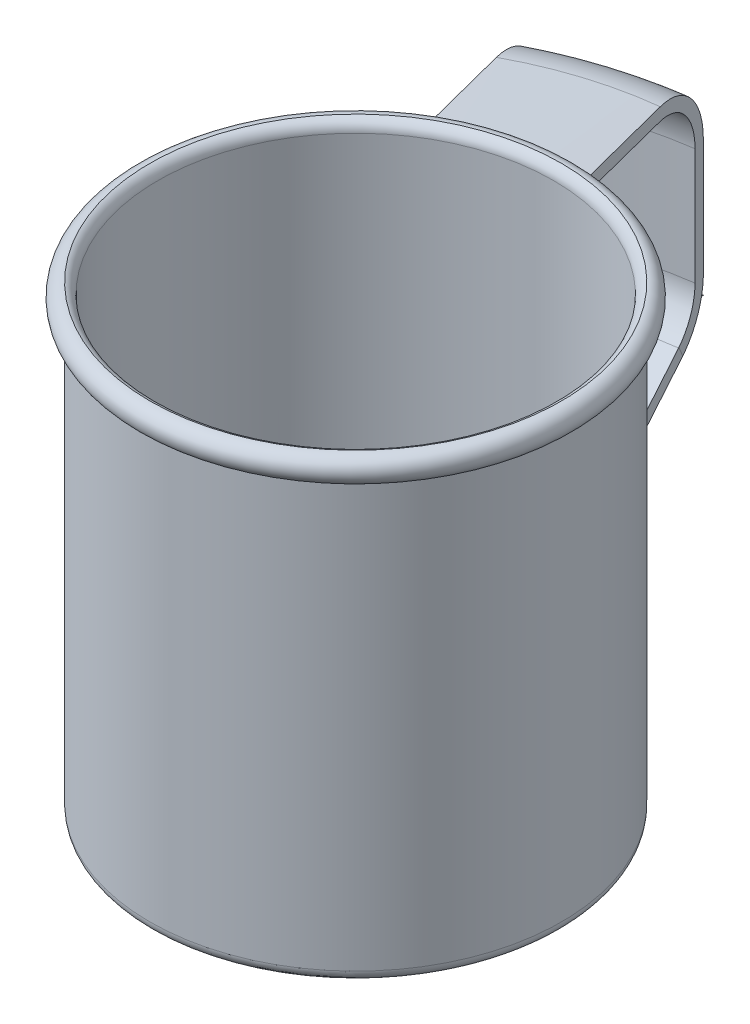
from build123d import *

# Parameters (mm, degrees)
FILLET1_R          = 2
FILLET2_R          = 2
REVOLVE3_ANGLE     = 34.5
CUT_EXTRUDE1_START = 17.048322615
CUT_EXTRUDE1_DEPTH = 62.951677385
CUT_EXTRUDE2_REACH = 148.807
SKETCH6_W          = 2.656451676
SKETCH6_H          = 26.566734065
SKETCH6_W_2        = 2.656451675
CUT_EXTRUDE4_DEPTH = 3.1


with BuildPart() as part:
    # Sketch3 → Revolve2 (revolve)
    with BuildSketch(Plane(origin=(0, 0, 0), x_dir=(0, 0, -1), z_dir=(1, 0, 0))):
        with BuildLine():
            Line((0, 0), (36, 0))
            Line((36, 0), (36, 76.3))
            ThreePointArc((36, 76.3), (38.3, 78.6), (36, 80.9))
            Line((36, 80.9), (34.6, 80.9))
            Line((34.6, 80.9), (34.6, 76.3))
            Line((34.6, 76.3), (34.6, 1.4))
            Line((34.6, 1.4), (0, 1.4))
            Line((0, 1.4), (0, 0))
        make_face()
    revolve(axis=Axis((0, 0, 0), (0, 1, 0)))

    # Fillet1
    # the kernel refuses this fillet: 2 mm, written as the material it takes off along each edge
    with BuildSketch(Plane(origin=(0, 80.9, 0), x_dir=(0, 0, -1), z_dir=(1, 0, 0))) as fillet1_piece_1:
        with BuildLine():
            CenterArc((36.6, -1.907878403), FILLET1_R, 107.457603124, 72.542396876)
            Line((34.6, -1.907878403), (34.56, -1.907878403))
            Line((34.56, -1.907878403), (34.56, 0))
            Line((34.56, 0), (34.6, 0.04))
            ThreePointArc((34.6, 0.04), (35.3, 0.04), (35.988, 0.038157568))
            Line((35.988, 0.038157568), (36, 0))
        make_face()
    revolve(axis=Axis((0, 80.9, 0), (0, 1, 0)), mode=Mode.SUBTRACT)

    # Fillet2
    fillet2_edges = [part.edges().sort_by_distance(p)[0] for p in [
        (0, 0, 36),
    ]]
    fillet(fillet2_edges, radius=FILLET2_R)

    # Sketch4 → Revolve3 (revolve)
    with BuildSketch(Plane(origin=(0, 0, 0), x_dir=(0, 0, -1), z_dir=(1, 0, 0))):
        with BuildLine():
            Line((66.418368133, 32.345231294), (37.015359732, 17.048322615))
            Line((37.015359732, 17.048322615), (36, 9))
            Line((36, 9), (36, 19))
            Line((36, 19), (65.403008401, 34.296908679))
            ThreePointArc((65.403008401, 34.296908679), (68.549568046, 37.242877581), (69.710791194, 41.393917351))
            Line((69.710791194, 41.393917351), (69.710791194, 61.739552218))
            ThreePointArc((69.710791194, 61.739552218), (67.034063035, 68.549081537), (60.436853284, 71.71315908))
            Line((60.436853284, 71.71315908), (36, 73.492121597))
            Line((36, 73.492121597), (36, 75.686315107))
            Line((36, 75.686315107), (36.15973366, 75.686315107))
            Line((36.15973366, 75.686315107), (60.596586944, 73.90735259))
            ThreePointArc((60.596586944, 73.90735259), (68.64518284, 70.047177987), (71.910791194, 61.739552218))
            Line((71.910791194, 61.739552218), (71.910791194, 41.393917351))
            ThreePointArc((71.910791194, 41.393917351), (70.43023168, 36.101341644), (66.418368133, 32.345231294))
        make_face()
    revolve(axis=Axis((0, 0, 0), (0, 1, 0)), revolution_arc=REVOLVE3_ANGLE)

    # Cut-Extrude1: read off the stored shape, not the designer's step
    # Cut-Extrude1 outline → Cut-Extrude1 (cut)
    with BuildSketch(Plane(origin=(0, 0, 0), x_dir=(1, 0, 0), z_dir=(0, 1, 0)).offset(CUT_EXTRUDE1_START)):
        with BuildLine():
            Line((-22.108668816, 32.168312739), (-32.047363038, 63.91139403))
            Line((-32.047363038, 63.91139403), (-34.272292741, 63.218445413))
            ThreePointArc((-34.272292741, 63.218445413), (-37.553605301, 61.326084329), (-40.730720635, 59.263566268))
            Line((-40.730720635, 59.263566268), (-22.108668816, 32.168312739))
        make_face()
        with BuildLine():
            Line((0, 38.304663112), (0, 71.910791194))
            ThreePointArc((0, 71.910791194), (-3.848061143, 71.807759438), (-7.685095499, 71.498959414))
            Line((-7.685095499, 71.498959414), (-10.221387179, 70.709037913))
            Line((-10.221387179, 70.709037913), (-0.068922433, 38.283197398))
            Line((-0.068922433, 38.283197398), (0, 38.304663112))
        make_face()
    extrude(amount=CUT_EXTRUDE1_DEPTH, mode=Mode.SUBTRACT)

    # Cut-Extrude2: up to this plane
    cut_extrude2_end = Plane(origin=(-22.697932128, 11.704801269, -66.823250171), z_dir=(0.2973592990807489, 0, 0.9547656504348101))
    # Sketch6 → Cut-Extrude2 (cut, up to the surface)
    with BuildSketch(Plane(origin=(-21.486572607, 0, -68.625717394), x_dir=(-0.9543173737069837, 0, 0.2987948296758254), z_dir=(-0.2987948296758254, 0, -0.9543173737069837)), mode=Mode.PRIVATE) as cut_extrude2_sk1:
        with Locations((-12.701273409, 51.798619412)):
            Rectangle(SKETCH6_W, SKETCH6_H)
    cut_extrude2_tool1 = split(extrude(cut_extrude2_sk1.sketch, amount=-CUT_EXTRUDE2_REACH, mode=Mode.PRIVATE), bisect_by=cut_extrude2_end, keep=Keep.BOTH, mode=Mode.PRIVATE)
    add(cut_extrude2_tool1.solids().sort_by_distance((-9.365527, 51.798619, -72.420792))[0], mode=Mode.SUBTRACT)
    # Sketch6 → Cut-Extrude2 (cut, up to the surface)
    with BuildSketch(Plane(origin=(-21.486572607, 0, -68.625717394), x_dir=(-0.9543173737069837, 0, 0.2987948296758254), z_dir=(-0.2987948296758254, 0, -0.9543173737069837)), mode=Mode.PRIVATE) as cut_extrude2_sk2:
        with Locations((12.815187073, 51.798619412)):
            Rectangle(SKETCH6_W_2, SKETCH6_H)
    cut_extrude2_tool2 = split(extrude(cut_extrude2_sk2.sketch, amount=-CUT_EXTRUDE2_REACH, mode=Mode.PRIVATE), bisect_by=cut_extrude2_end, keep=Keep.BOTH, mode=Mode.PRIVATE)
    add(cut_extrude2_tool2.solids().sort_by_distance((-33.716328, 51.798619, -64.796606))[0], mode=Mode.SUBTRACT)

    # Sketch7 → Cut-Extrude4 (cut)
    with BuildSketch(Plane(origin=(-0.27023011, -1.738396159, -0.863084843), x_dir=(-0.9904458888228052, 0.12351648622229915, 0.06132388560177964), z_dir=(-0.13790192643325755, -0.8871260840574537, -0.4404433785072538))):
        Polygon((30.594390354, 67.226140182), (21.000465395, 34.90437265), (24.682862396, 33.889860102), (33.633833507, 66.37938352), align=None)
        Polygon((5.560376818, 74.302956644), (8.594011842, 73.435621609), (-0.126879919, 40.867445433), (-3.796298497, 41.927940925), align=None)
    extrude(amount=-CUT_EXTRUDE4_DEPTH, mode=Mode.SUBTRACT)


solid = part.part
